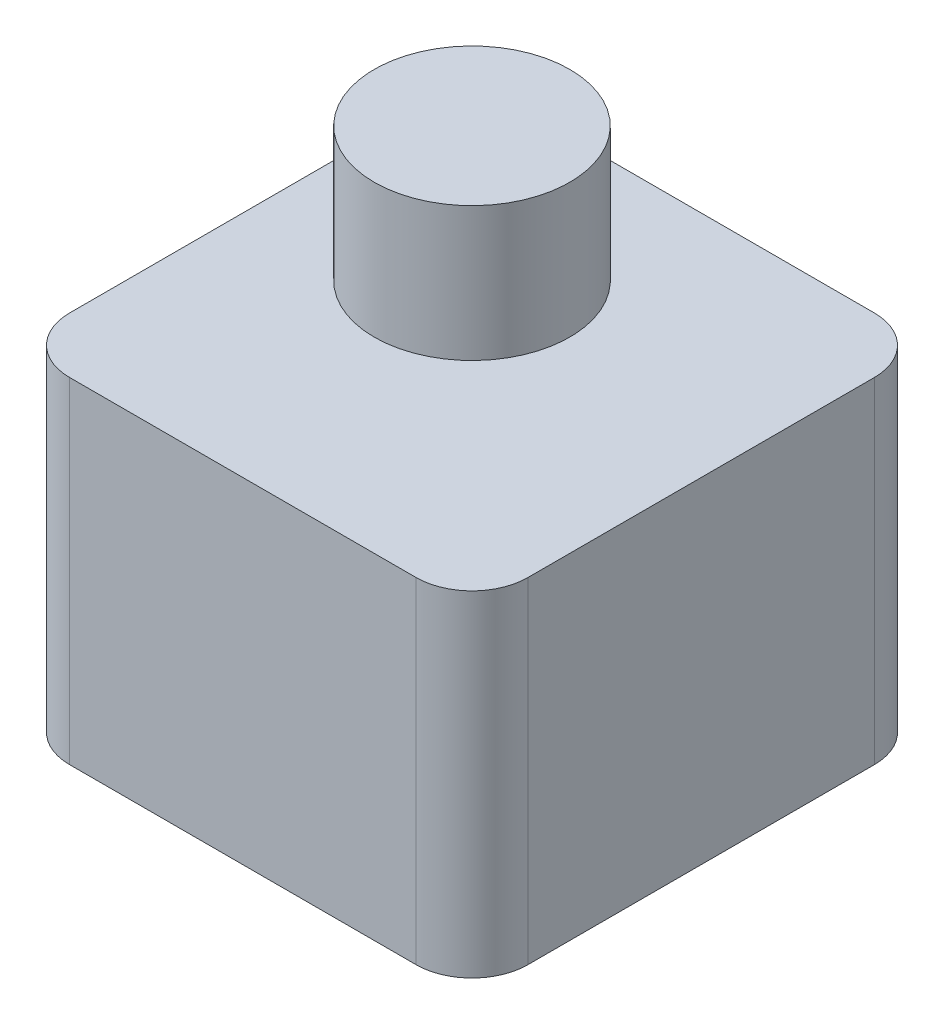
from build123d import *

# Parameters (mm, degrees)
SALIENTE_EXTRUIR2_DEPTH = 30
CROQUIS3_R              = 1.5
SALIENTE_EXTRUIR3_DEPTH = 17
CROQUIS6_R              = 8.75
SALIENTE_EXTRUIR4_DEPTH = 12


with BuildPart() as part:
    # Croquis2 → Saliente-Extruir2 (new body)
    with BuildSketch(Plane(origin=(0, 0, 0), x_dir=(1, 0, 0), z_dir=(0, 1, 0))):
        with BuildLine():
            Line((5, 41), (36, 41))
            ThreePointArc((36, 41), (39.535533906, 39.535533906), (41, 36))
            Line((41, 36), (41, 5))
            ThreePointArc((41, 5), (39.535533906, 1.464466094), (36, 0))
            Line((36, 0), (5, 0))
            ThreePointArc((5, 0), (1.464466094, 1.464466094), (0, 5))
            Line((0, 5), (0, 36))
            ThreePointArc((0, 36), (1.464466094, 39.535533906), (5, 41))
        make_face()
    extrude(amount=SALIENTE_EXTRUIR2_DEPTH)


with BuildPart() as body_2:
    # Croquis3 → Saliente-Extruir3 (new body)
    with BuildSketch(Plane(origin=(0, 30, 0), x_dir=(1, 0, 0), z_dir=(0, 1, 0))):
        with Locations((20.5, 20.5)):
            Circle(CROQUIS3_R)
    extrude(amount=SALIENTE_EXTRUIR3_DEPTH)

    # Croquis6 → Saliente-Extruir4 (add)
    with BuildSketch(Plane(origin=(0, 35, 0), x_dir=(1, 0, 0), z_dir=(0, 1, 0))):
        with Locations((20.5, 20.5)):
            Circle(CROQUIS6_R)
    extrude(amount=SALIENTE_EXTRUIR4_DEPTH)


solid = Compound([part.part, body_2.part])
